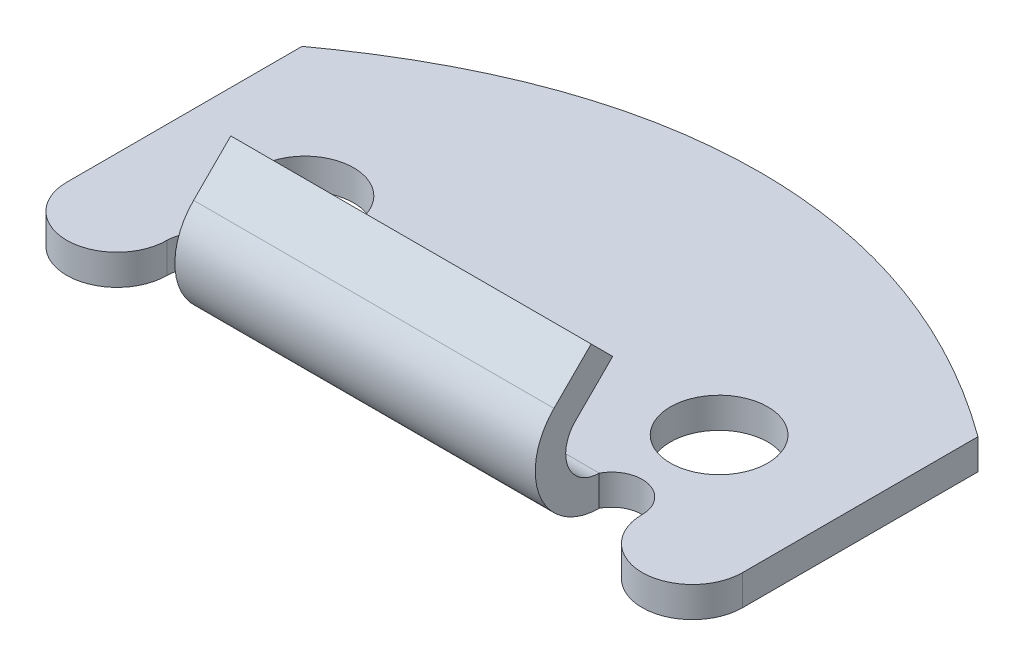
from build123d import *

# Parameters (mm, degrees)
SKETCH1_R           = 1.6
BOSS_EXTRUDE1_DEPTH = 1
THICKEN2_START      = -5.917392258
THICKEN2_DEPTH      = 11.834784516


# Read off the part's stored shape, not the designer's step: Thicken2
with BuildPart() as part:
    # Sketch1 → Boss-Extrude1 (new body)
    with BuildSketch(Plane(origin=(0, 0, 0), x_dir=(1, 0, 0), z_dir=(0, 1, 0))):
        with BuildLine():
            Line((-11.1, 4.202456856), (-11.1, -3.525300194))
            ThreePointArc((-11.1, -3.525300194), (-9.45, -5.175300194), (-7.8, -3.525300194))
            ThreePointArc((-7.8, -3.525300194), (-7.04227284, -2.555092036), (-5.917392258, -3.055190021))
            Line((-5.917392258, -3.055190021), (5.917392258, -3.055190021))
            ThreePointArc((5.917392258, -3.055190021), (7.04227284, -2.555092036), (7.8, -3.525300194))
            ThreePointArc((7.8, -3.525300194), (9.45, -5.175300194), (11.1, -3.525300194))
            Line((11.1, -3.525300194), (11.1, 4.202456856))
            add(Edge.make_bspline(
                [(11.1, 4.202456856), (5.688924475, 8.144809979), (0, 8.144809979)],
                knots=[0, 0, 0, 1, 1, 1], degree=2))
            add(Edge.make_bspline(
                [(-11.1, 4.202456856), (-5.688924475, 8.144809979), (0, 8.144809979)],
                knots=[0, 0, 0, 1, 1, 1], degree=2))
        make_face()
        with Locations(Location((-6.8, 0, 0), (0, 0, 270))):
            Circle(SKETCH1_R, mode=Mode.SUBTRACT)
        with Locations(Location((6.8, 0, 0), (0, 0, 90))):
            Circle(SKETCH1_R, mode=Mode.SUBTRACT)
    extrude(amount=BOSS_EXTRUDE1_DEPTH)

    # Thicken2 outline → Thicken2 (add)
    with BuildSketch(Plane.YZ.offset(THICKEN2_START)):
        with BuildLine():
            Line((2.877817459, 3.833007481), (4.098758354, 2.612066586))
            Line((4.098758354, 2.612066586), (4.805865135, 3.319173367))
            Line((4.805865135, 3.319173367), (3.58492424, 4.540114262))
            ThreePointArc((3.58492424, 4.540114262), (1.296364791, 4.99533704), (0, 3.055190021))
            Line((0, 3.055190021), (1, 3.055190021))
            ThreePointArc((1, 3.055190021), (1.679048224, 4.071457507), (2.877817459, 3.833007481))
        make_face()
    extrude(amount=THICKEN2_DEPTH)


solid = part.part
